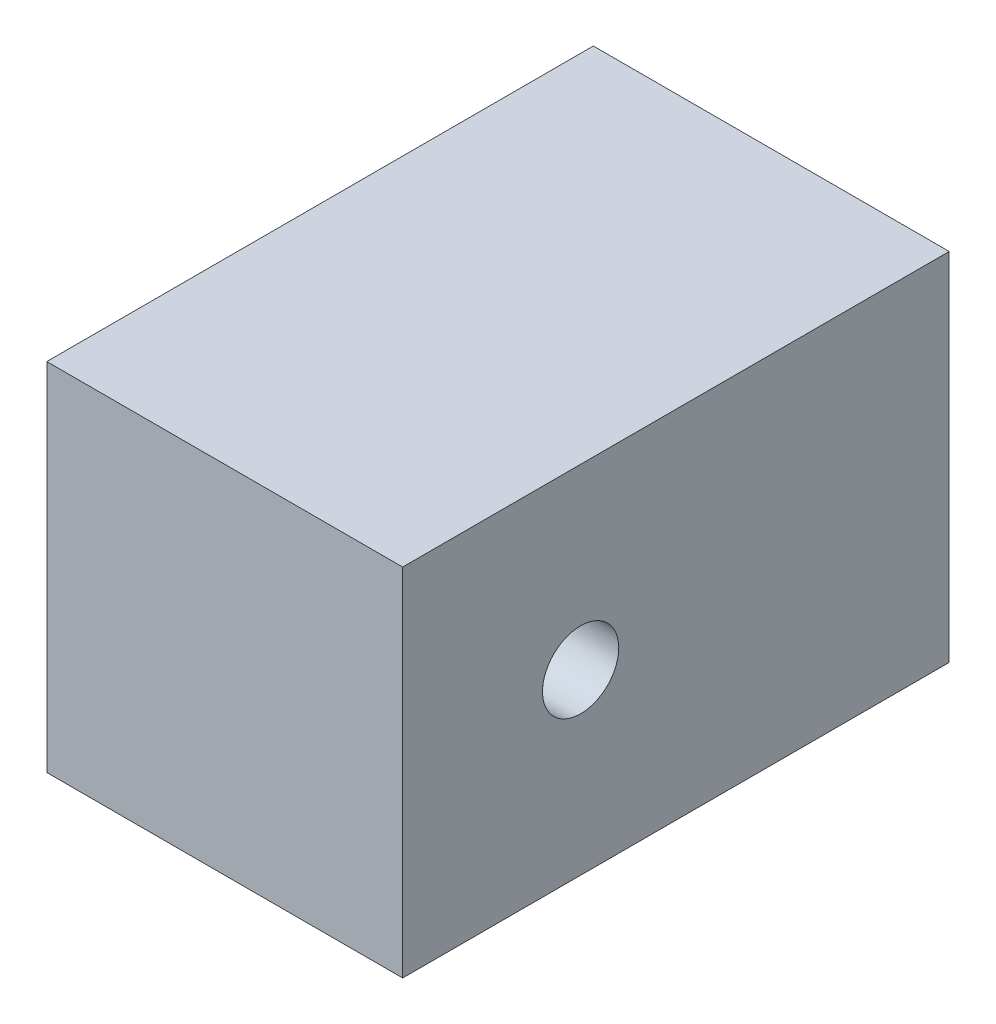
from build123d import *

# Parameters (mm, degrees)
CROQUIS1_W              = 28
CROQUIS1_H              = 28
SALIENTE_EXTRUIR1_DEPTH = 28
CROQUIS4_R              = 3.175
CORTAR_EXTRUIR3_DEPTH   = 10
CROQUIS6_R              = 3
CORTAR_EXTRUIR4_DEPTH   = 10
CROQUIS7_W              = 28
CROQUIS7_H              = 28
SALIENTE_EXTRUIR2_DEPTH = 15


with BuildPart() as part:
    # Croquis1 → Saliente-Extruir1 (new body)
    with BuildSketch(Plane.XY):
        with Locations((14, 14)):
            Rectangle(CROQUIS1_W, CROQUIS1_H)
    extrude(amount=SALIENTE_EXTRUIR1_DEPTH)

    # Croquis4 → Cortar-Extruir3 (cut)
    with BuildSketch(Plane.ZY):
        with Locations((14, 14)):
            Circle(CROQUIS4_R)
    extrude(amount=-CORTAR_EXTRUIR3_DEPTH, mode=Mode.SUBTRACT)

    # Croquis6 → Cortar-Extruir4 (cut)
    with BuildSketch(Plane(origin=(28, 0, 0), x_dir=(0, 0, -1), z_dir=(1, 0, 0))):
        with Locations((-14, 14)):
            Circle(CROQUIS6_R)
    extrude(amount=-CORTAR_EXTRUIR4_DEPTH, mode=Mode.SUBTRACT)

    # Croquis7 → Saliente-Extruir2 (add)
    with BuildSketch(Plane(origin=(0, 0, 0), x_dir=(-1, 0, 0), z_dir=(0, 0, -1))):
        with Locations((-14, 14)):
            Rectangle(CROQUIS7_W, CROQUIS7_H)
    extrude(amount=SALIENTE_EXTRUIR2_DEPTH)


solid = part.part
